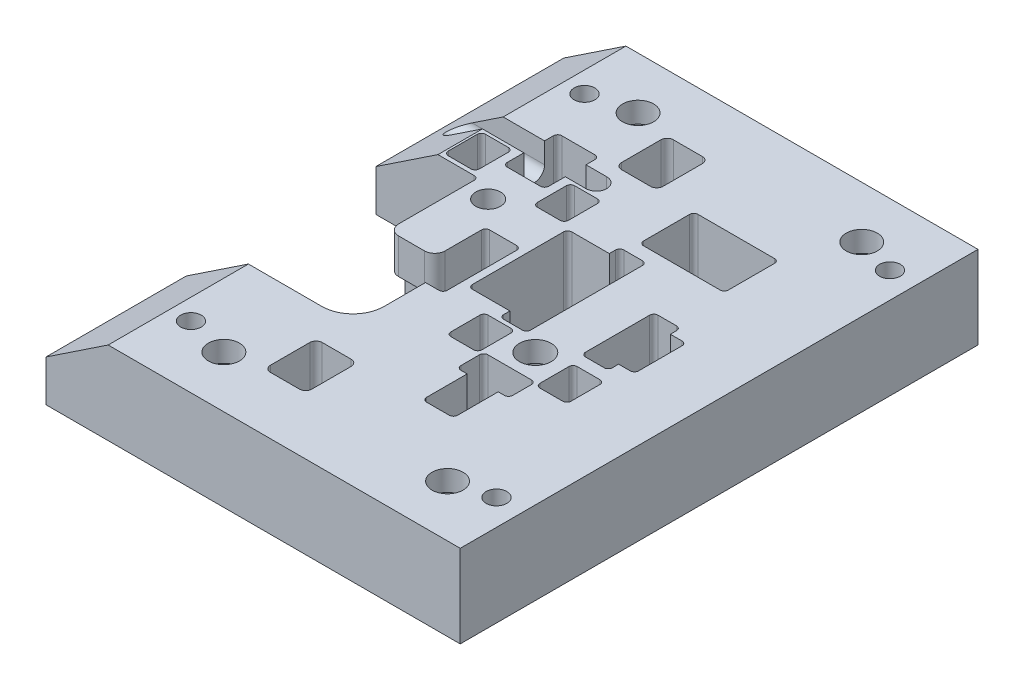
from build123d import *
from OCP.BRepFilletAPI import BRepFilletAPI_MakeChamfer

# Parameters (mm, degrees)
SKETCH1_W                    = 200
SKETCH1_H                    = 250
BOSS_EXTRUDE1_DEPTH          = 40
CUT_EXTRUDE2_REACH           = 167
FILLET3_R                    = 2
CUT_EXTRUDE3_REACH           = 167
FILLET4_R                    = 2
CUT_EXTRUDE4_REACH           = 167
FILLET5_R                    = 2
CUT_EXTRUDE5_REACH           = 167
SKETCH6_W                    = 41
SKETCH6_H                    = 26.3
FILLET6_R                    = 2
CUT_EXTRUDE6_REACH           = 167
CUT_EXTRUDE7_REACH           = 167
CUT_EXTRUDE12_REACH          = 167
CUT_EXTRUDE15_DEPTH          = 5
FILLET9_R                    = 5
CUT_EXTRUDE14_REACH          = 167
CUT_EXTRUDE16_REACH          = 167
FILLET10_R                   = 2
SKETCH27_W                   = 8
SKETCH27_H                   = 23
CUT_EXTRUDE17_DEPTH          = 18.5
FILLET11_R                   = 3
FILLET12_R                   = 15
FILLET13_R                   = 5
CHAMFER1_SIZE                = 20
CHAMFER1_SIZE2               = 30
CUT_EXTRUDE18_REACH          = 167
CUT_EXTRUDE19_REACH          = 167
SKETCH30_R                   = 7.684556177
SKETCH31_R                   = 10
CUT_EXTRUDE20_DEPTH          = 30
CUT_EXTRUDE21_REACH          = 167
SKETCH33_R                   = 6
SKETCH34_R                   = 9
CUT_EXTRUDE22_DEPTH          = 31
M10_TAPPED_HOLE1_D           = 8.5
M10_TAPPED_HOLE1_DEPTH       = 27.5
M10_TAPPED_HOLE1_CSINK_D     = 10.05
M10_TAPPED_HOLE1_CSINK_ANGLE = 90
M10_TAPPED_HOLE1_TIP         = 2.553657631
F_10_0MM_DOWEL_HOLE1_D       = 10
CUT_EXTRUDE23_REACH          = 167
SKETCH41_R                   = 7.5
SKETCH42_R                   = 9
CUT_EXTRUDE24_DEPTH          = 30


with BuildPart() as part:
    # Sketch1 → Boss-Extrude1 (new body)
    with BuildSketch(Plane(origin=(0, 0, 0), x_dir=(1, 0, 0), z_dir=(0, 1, 0))):
        Rectangle(SKETCH1_W, SKETCH1_H)
    extrude(amount=BOSS_EXTRUDE1_DEPTH)

    # Sketch3 → Cut-Extrude2 (cut, up to next)
    with BuildSketch(Plane(origin=(0, 40, 0), x_dir=(1, 0, 0), z_dir=(0, 1, 0)), mode=Mode.PRIVATE) as cut_extrude2_sk1:
        Polygon((28.75, -72.03), (43.75, -72.03), (43.75, -50.4), (48.75, -50.4), (48.75, -37.4), (23.75, -37.4), (23.75, -50.4), (28.75, -50.4), align=None)
    cut_extrude2_tool1 = extrude(cut_extrude2_sk1.sketch, amount=-CUT_EXTRUDE2_REACH, mode=Mode.PRIVATE) & part.part
    add(cut_extrude2_tool1.solids().sort_by_distance((36.25, 40, 52.550168))[0], mode=Mode.SUBTRACT)

    # Fillet3
    fillet3_edges = [part.edges().sort_by_distance(p)[0] for p in [
        (23.75, 20, 50.4),
        (23.75, 20, 37.4),
        (48.75, 20, 37.4),
        (48.75, 20, 50.4),
        (43.75, 20, 72.03),
        (28.75, 20, 72.03),
    ]]
    fillet(fillet3_edges, radius=FILLET3_R)

    # Sketch4 → Cut-Extrude3 (cut, up to next)
    with BuildSketch(Plane(origin=(0, 40, 0), x_dir=(1, 0, 0), z_dir=(0, 1, 0)), mode=Mode.PRIVATE) as cut_extrude3_sk1:
        Polygon((48.25, -14.77), (61.25, -14.77), (61.25, -9.77), (68.88, -9.77), (68.88, 15.23), (61.25, 15.23), (61.25, 20.23), (48.25, 20.23), align=None)
    cut_extrude3_tool1 = extrude(cut_extrude3_sk1.sketch, amount=-CUT_EXTRUDE3_REACH, mode=Mode.PRIVATE) & part.part
    add(cut_extrude3_tool1.solids().sort_by_distance((57.796978, 40, -2.73))[0], mode=Mode.SUBTRACT)

    # Fillet4
    fillet4_edges = [part.edges().sort_by_distance(p)[0] for p in [
        (68.88, 20, 9.77),
        (61.25, 20, 14.77),
        (48.25, 20, 14.77),
        (48.25, 20, -20.23),
        (61.25, 20, -20.23),
        (68.88, 20, -15.23),
    ]]
    fillet(fillet4_edges, radius=FILLET4_R)

    # Sketch5 → Cut-Extrude4 (cut, up to next)
    with BuildSketch(Plane(origin=(0, 40, 0), x_dir=(1, 0, 0), z_dir=(0, 1, 0)), mode=Mode.PRIVATE) as cut_extrude4_sk1:
        Polygon((-7.37, -13.77), (12.75, -13.77), (12.75, -18.77), (25.75, -18.77), (25.75, 39.23), (12.75, 39.23), (12.75, 34.23), (-7.37, 34.23), align=None)
    cut_extrude4_tool1 = extrude(cut_extrude4_sk1.sketch, amount=-CUT_EXTRUDE4_REACH, mode=Mode.PRIVATE) & part.part
    add(cut_extrude4_tool1.solids().sort_by_distance((9.950455, 40, -10.23))[0], mode=Mode.SUBTRACT)

    # Fillet5
    fillet5_edges = [part.edges().sort_by_distance(p)[0] for p in [
        (-7.37, 20, 13.77),
        (-7.37, 20, -34.23),
        (12.75, 20, -39.23),
        (25.75, 20, -39.23),
        (25.75, 20, 18.77),
        (12.75, 20, 18.77),
    ]]
    fillet(fillet5_edges, radius=FILLET5_R)

    # Sketch6 → Cut-Extrude5 (cut, up to next)
    with BuildSketch(Plane(origin=(0, 40, 0), x_dir=(1, 0, 0), z_dir=(0, 1, 0)), mode=Mode.PRIVATE) as cut_extrude5_sk1:
        with Locations((36.25, 58.88)):
            Rectangle(SKETCH6_W, SKETCH6_H)
    cut_extrude5_tool1 = extrude(cut_extrude5_sk1.sketch, amount=-CUT_EXTRUDE5_REACH, mode=Mode.PRIVATE) & part.part
    add(cut_extrude5_tool1.solids().sort_by_distance((36.25, 40, -58.88))[0], mode=Mode.SUBTRACT)

    # Fillet6
    fillet6_edges = [part.edges().sort_by_distance(p)[0] for p in [
        (15.75, 20, -72.03),
        (56.75, 20, -72.03),
        (56.75, 20, -45.73),
        (15.75, 20, -45.73),
    ]]
    fillet(fillet6_edges, radius=FILLET6_R)

    # Sketch7 → Cut-Extrude6 (cut, up to next)
    with BuildSketch(Plane(origin=(0, 40, 0), x_dir=(1, 0, 0), z_dir=(0, 1, 0)), mode=Mode.PRIVATE) as cut_extrude6_sk1:
        with BuildLine():
            Line((63.25, -20.77), (52.25, -20.77))
            ThreePointArc((52.25, -20.77), (50.835786438, -21.355786438), (50.25, -22.77))
            Line((50.25, -22.77), (50.25, -36.77))
            ThreePointArc((50.25, -36.77), (50.835786438, -38.184213562), (52.25, -38.77))
            Line((52.25, -38.77), (63.25, -38.77))
            ThreePointArc((63.25, -38.77), (64.664213562, -38.184213562), (65.25, -36.77))
            Line((65.25, -36.77), (65.25, -22.77))
            ThreePointArc((65.25, -22.77), (64.664213562, -21.355786438), (63.25, -20.77))
        make_face()
    cut_extrude6_tool1 = extrude(cut_extrude6_sk1.sketch, amount=-CUT_EXTRUDE6_REACH, mode=Mode.PRIVATE) & part.part
    add(cut_extrude6_tool1.solids().sort_by_distance((57.75, 40, 29.77))[0], mode=Mode.SUBTRACT)

    # Sketch8 → Cut-Extrude7 (cut, up to next)
    with BuildSketch(Plane(origin=(0, 40, 0), x_dir=(1, 0, 0), z_dir=(0, 1, 0)), mode=Mode.PRIVATE) as cut_extrude7_sk1:
        with BuildLine():
            Line((9.25, -20.77), (20.25, -20.77))
            ThreePointArc((20.25, -20.77), (21.664213562, -21.355786438), (22.25, -22.77))
            Line((22.25, -22.77), (22.25, -36.77))
            ThreePointArc((22.25, -36.77), (21.664213562, -38.184213562), (20.25, -38.77))
            Line((20.25, -38.77), (9.25, -38.77))
            ThreePointArc((9.25, -38.77), (7.835786438, -38.184213562), (7.25, -36.77))
            Line((7.25, -36.77), (7.25, -22.77))
            ThreePointArc((7.25, -22.77), (7.835786438, -21.355786438), (9.25, -20.77))
        make_face()
    cut_extrude7_tool1 = extrude(cut_extrude7_sk1.sketch, amount=-CUT_EXTRUDE7_REACH, mode=Mode.PRIVATE) & part.part
    add(cut_extrude7_tool1.solids().sort_by_distance((14.75, 40, 29.77))[0], mode=Mode.SUBTRACT)

    # Sketch21 → Cut-Extrude12 (cut, up to next)
    with BuildSketch(Plane(origin=(0, 40, 0), x_dir=(1, 0, 0), z_dir=(0, 1, 0)), mode=Mode.PRIVATE) as cut_extrude12_sk1:
        with BuildLine():
            Line((-24, 54.23), (-13, 54.23))
            ThreePointArc((-13, 54.23), (-11.585786438, 53.644213562), (-11, 52.23))
            Line((-11, 52.23), (-11, 38.23))
            ThreePointArc((-11, 38.23), (-11.585786438, 36.815786438), (-13, 36.23))
            Line((-13, 36.23), (-24, 36.23))
            ThreePointArc((-24, 36.23), (-25.414213562, 36.815786438), (-26, 38.23))
            Line((-26, 38.23), (-26, 52.23))
            ThreePointArc((-26, 52.23), (-25.414213562, 53.644213562), (-24, 54.23))
        make_face()
    cut_extrude12_tool1 = extrude(cut_extrude12_sk1.sketch, amount=-CUT_EXTRUDE12_REACH, mode=Mode.PRIVATE) & part.part
    # Sketch21 → Cut-Extrude12 (cut, up to next)
    with BuildSketch(Plane(origin=(0, 40, 0), x_dir=(1, 0, 0), z_dir=(0, 1, 0)), mode=Mode.PRIVATE) as cut_extrude12_sk2:
        with BuildLine():
            Line((-69, 52.23), (-69, 38.23))
            ThreePointArc((-69, 38.23), (-68.414213562, 36.815786438), (-67, 36.23))
            Line((-67, 36.23), (-56, 36.23))
            ThreePointArc((-56, 36.23), (-54.585786438, 36.815786438), (-54, 38.23))
            Line((-54, 38.23), (-54, 52.23))
            ThreePointArc((-54, 52.23), (-54.585786438, 53.644213562), (-56, 54.23))
            Line((-56, 54.23), (-67, 54.23))
            ThreePointArc((-67, 54.23), (-68.414213562, 53.644213562), (-69, 52.23))
        make_face()
    cut_extrude12_tool2 = extrude(cut_extrude12_sk2.sketch, amount=-CUT_EXTRUDE12_REACH, mode=Mode.PRIVATE) & part.part
    add(cut_extrude12_tool1.solids().sort_by_distance((-18.5, 40, -45.23))[0], mode=Mode.SUBTRACT)
    add(cut_extrude12_tool2.solids().sort_by_distance((-61.5, 40, -45.23))[0], mode=Mode.SUBTRACT)

    # Sketch24 → Cut-Extrude15 (cut, symmetric)
    with BuildSketch(Plane(origin=(0, 0, -60.727981881), x_dir=(-1, 0, 0), z_dir=(0, 0, -1))):
        with BuildLine():
            Line((15, 40), (15, 35))
            ThreePointArc((15, 35), (17.928932188, 27.928932188), (25, 25))
            Line((25, 25), (100, 25))
            Line((100, 25), (100, 40))
            Line((100, 40), (15, 40))
        make_face()
    extrude(amount=CUT_EXTRUDE15_DEPTH, both=True, mode=Mode.SUBTRACT)

    # Fillet9
    fillet9_edges = [part.edges().sort_by_distance(p)[0] for p in [
        (-62.5, 25, -55.727981881),
        (-17.928932188, 27.928932188, -55.727981881),
        (-15, 37.5, -55.727981881),
        (-15, 37.5, -65.727981881),
        (-62.5, 25, -65.727981881),
    ]]
    fillet(fillet9_edges, radius=FILLET9_R - 0.0001)  # a hair under: the kernel refuses the full size

    # Sketch23 → Cut-Extrude14 (cut, up to next)
    with BuildSketch(Plane(origin=(0, 40, 0), x_dir=(1, 0, 0), z_dir=(0, 1, 0)), mode=Mode.PRIVATE) as cut_extrude14_sk1:
        with BuildLine():
            Line((-48, 72.03), (-32, 72.03))
            ThreePointArc((-32, 72.03), (-30.585786438, 71.444213562), (-30, 70.03))
            Line((-30, 70.03), (-30, 47.73))
            ThreePointArc((-30, 47.73), (-30.585786438, 46.315786438), (-32, 45.73))
            Line((-32, 45.73), (-48, 45.73))
            ThreePointArc((-48, 45.73), (-49.414213562, 46.315786438), (-50, 47.73))
            Line((-50, 47.73), (-50, 70.03))
            ThreePointArc((-50, 70.03), (-49.414213562, 71.444213562), (-48, 72.03))
        make_face()
    cut_extrude14_tool1 = extrude(cut_extrude14_sk1.sketch, amount=-CUT_EXTRUDE14_REACH, mode=Mode.PRIVATE) & part.part
    add(cut_extrude14_tool1.solids().sort_by_distance((-40, 40, -58.88))[0], mode=Mode.SUBTRACT)

    # Sketch26 → Cut-Extrude16 (cut, up to next)
    with BuildSketch(Plane(origin=(0, 40, 0), x_dir=(1, 0, 0), z_dir=(0, 1, 0)), mode=Mode.PRIVATE) as cut_extrude16_sk1:
        Polygon((-100, 34.23), (-50.5, 34.23), (-50.5, -9.27), (-28, -9.27), (-28, 15.23), (-11, 15.23), (-11, -22.27), (-19.5, -22.27), (-19.5, -57.27), (-100, -57.27), align=None)
    cut_extrude16_tool1 = extrude(cut_extrude16_sk1.sketch, amount=-CUT_EXTRUDE16_REACH, mode=Mode.PRIVATE) & part.part
    add(cut_extrude16_tool1.solids().sort_by_distance((-61.536912, 40, 15.614339))[0], mode=Mode.SUBTRACT)

    # Fillet10
    fillet10_edges = [part.edges().sort_by_distance(p)[0] for p in [
        (-50.5, 20, -34.23),
        (-28, 20, -15.23),
        (-11, 20, -15.23),
        (-11, 20, 22.27),
    ]]
    fillet(fillet10_edges, radius=FILLET10_R)

    # Sketch27 → Cut-Extrude17 (cut)
    with BuildSketch(Plane.ZY.offset(50.5)):
        with Locations((5.27, 11.5)):
            Rectangle(SKETCH27_W, SKETCH27_H)
    extrude(amount=-CUT_EXTRUDE17_DEPTH, mode=Mode.SUBTRACT)

    # Fillet11
    fillet11_edges = [part.edges().sort_by_distance(p)[0] for p in [
        (-41.25, 23, 1.27),
        (-32, 11.5, 1.27),
        (-32, 23, 5.27),
    ]]
    fillet(fillet11_edges, radius=FILLET11_R)

    # Fillet12
    fillet12_edges = [part.edges().sort_by_distance(p)[0] for p in [
        (-19.5, 20, 57.27),
    ]]
    fillet(fillet12_edges, radius=FILLET12_R)

    # Fillet13
    fillet13_edges = [part.edges().sort_by_distance(p)[0] for p in [
        (-50.5, 31.5, 9.27),
        (-28, 20, 9.27),
    ]]
    fillet(fillet13_edges, radius=FILLET13_R)

    # Chamfer1: one chamfer whose edges measure the first distance from different faces: ONE call of the kernel's chamfer builder (chamfer() names one face for all edges)
    chamfer1_edges_1 = [part.edges().sort_by_distance(p)[0] for p in [
        (-100, 40, -44.978990941),
    ]]
    chamfer1_side_1 = [part.faces().sort_by_distance(p)[0] for p in [
        (-100, 19.481783405, -80.368366472),
    ]]
    chamfer1_edges_2 = [part.edges().sort_by_distance(p)[0] for p in [
        (-100, 40, 91.135),
    ]]
    chamfer1_side_2 = [part.faces().sort_by_distance(p)[0] for p in [
        (-100, 20, 91.135),
    ]]
    chamfer1 = BRepFilletAPI_MakeChamfer(part.part.solid().wrapped)
    for e in chamfer1_edges_1:
        chamfer1.Add(CHAMFER1_SIZE, CHAMFER1_SIZE2, e.wrapped, chamfer1_side_1[0].wrapped)  # the first distance lies on this face
    for e in chamfer1_edges_2:
        chamfer1.Add(CHAMFER1_SIZE, CHAMFER1_SIZE2, e.wrapped, chamfer1_side_2[0].wrapped)  # the first distance lies on this face
    add(Compound.cast(chamfer1.Shape()), mode=Mode.REPLACE)

    # Sketch28 → Cut-Extrude18 (cut, up to next)
    with BuildSketch(Plane(origin=(0, 40, 0), x_dir=(1, 0, 0), z_dir=(0, 1, 0)), mode=Mode.PRIVATE) as cut_extrude18_sk1:
        with BuildLine():
            Line((-19.37, 97.265), (-5.37, 97.265))
            ThreePointArc((-5.37, 97.265), (-3.248679656, 96.386320344), (-2.37, 94.265))
            Line((-2.37, 94.265), (-2.37, 75.265))
            ThreePointArc((-2.37, 75.265), (-3.248679656, 73.143679656), (-5.37, 72.265))
            Line((-5.37, 72.265), (-19.37, 72.265))
            ThreePointArc((-19.37, 72.265), (-21.491320344, 73.143679656), (-22.37, 75.265))
            Line((-22.37, 75.265), (-22.37, 94.265))
            ThreePointArc((-22.37, 94.265), (-21.491320344, 96.386320344), (-19.37, 97.265))
        make_face()
    cut_extrude18_tool1 = extrude(cut_extrude18_sk1.sketch, amount=-CUT_EXTRUDE18_REACH, mode=Mode.PRIVATE) & part.part
    cut_extrude18 = cut_extrude18_tool1.solids().sort_by_distance((-12.37, 40, -84.765))[0]
    add(cut_extrude18, mode=Mode.SUBTRACT)

    # Mirror1: Cut-Extrude18 across plane
    add(cut_extrude18.mirror(Plane.XY), mode=Mode.SUBTRACT)

    # Sketch30 → Cut-Extrude19 (cut, up to next)
    with BuildSketch(Plane(origin=(0, 40, 0), x_dir=(1, 0, 0), z_dir=(0, 1, 0)), mode=Mode.PRIVATE) as cut_extrude19_sk1:
        with Locations(Location((36.25, -25, 0), (0, 0, 270))):
            Circle(SKETCH30_R)
    cut_extrude19_tool1 = extrude(cut_extrude19_sk1.sketch, amount=-CUT_EXTRUDE19_REACH, mode=Mode.PRIVATE) & part.part
    add(cut_extrude19_tool1.solids().sort_by_distance((36.25, 40, 25))[0], mode=Mode.SUBTRACT)

    # Sketch31 → Cut-Extrude20 (cut)
    with BuildSketch(Plane.XZ):
        with Locations(Location((36.25, 25, 0), (0, 0, 270))):
            Circle(SKETCH31_R)
    extrude(amount=-CUT_EXTRUDE20_DEPTH, mode=Mode.SUBTRACT)

    # Sketch33 → Cut-Extrude21 (cut, up to next)
    with BuildSketch(Plane(origin=(0, 40, 0), x_dir=(1, 0, 0), z_dir=(0, 1, 0)), mode=Mode.PRIVATE) as cut_extrude21_sk1:
        with Locations(Location((-39.25, 27.73, 0), (0, 0, 270))):
            Circle(SKETCH33_R)
    cut_extrude21_tool1 = extrude(cut_extrude21_sk1.sketch, amount=-CUT_EXTRUDE21_REACH, mode=Mode.PRIVATE) & part.part
    add(cut_extrude21_tool1.solids().sort_by_distance((-39.25, 40, -27.73))[0], mode=Mode.SUBTRACT)

    # Sketch34 → Cut-Extrude22 (cut)
    with BuildSketch(Plane.XZ):
        with Locations(Location((-39.25, -27.73, 0), (0, 0, 270))):
            Circle(SKETCH34_R)
    extrude(amount=-CUT_EXTRUDE22_DEPTH, mode=Mode.SUBTRACT)

    # M10 Tapped Hole1
    with Locations(Plane(origin=(0, 0, 0), x_dir=(-1, 0, 0), z_dir=(0, -1, 0))):
        with Locations((-87.5, 112.5), (60, 112.5), (60, -112.5), (-87.5, -112.5)):
            CounterSinkHole(M10_TAPPED_HOLE1_D / 2, M10_TAPPED_HOLE1_CSINK_D / 2, depth=M10_TAPPED_HOLE1_DEPTH, counter_sink_angle=M10_TAPPED_HOLE1_CSINK_ANGLE)
            with Locations((0, 0, -(M10_TAPPED_HOLE1_DEPTH + M10_TAPPED_HOLE1_TIP / 2))):  # 118° drill point
                Cone(0, M10_TAPPED_HOLE1_D / 2, M10_TAPPED_HOLE1_TIP, mode=Mode.SUBTRACT)

    # Ø10.0mm Dowel Hole1 (through all)
    with Locations(Plane(origin=(0, 0, 0), x_dir=(-1, 0, 0), z_dir=(0, -1, 0))):
        with Locations((-87.5, 95), (60, 95), (60, -95), (-87.5, -95)):
            Hole(F_10_0MM_DOWEL_HOLE1_D / 2)

    # Sketch41 → Cut-Extrude23 (cut, up to next)
    with BuildSketch(Plane(origin=(0, 40, 0), x_dir=(1, 0, 0), z_dir=(0, 1, 0)), mode=Mode.PRIVATE) as cut_extrude23_sk1:
        with Locations(Location((68.88, -100, 0), (0, 0, 270))):
            Circle(SKETCH41_R)
    cut_extrude23_tool1 = extrude(cut_extrude23_sk1.sketch, amount=-CUT_EXTRUDE23_REACH, mode=Mode.PRIVATE) & part.part
    # Sketch41 → Cut-Extrude23 (cut, up to next)
    with BuildSketch(Plane(origin=(0, 40, 0), x_dir=(1, 0, 0), z_dir=(0, 1, 0)), mode=Mode.PRIVATE) as cut_extrude23_sk2:
        with Locations(Location((-39.12, -100, 0), (0, 0, 270))):
            Circle(SKETCH41_R)
    cut_extrude23_tool2 = extrude(cut_extrude23_sk2.sketch, amount=-CUT_EXTRUDE23_REACH, mode=Mode.PRIVATE) & part.part
    # Sketch41 → Cut-Extrude23 (cut, up to next)
    with BuildSketch(Plane(origin=(0, 40, 0), x_dir=(1, 0, 0), z_dir=(0, 1, 0)), mode=Mode.PRIVATE) as cut_extrude23_sk3:
        with Locations(Location((68.88, 100, 0), (0, 0, 90))):
            Circle(SKETCH41_R)
    cut_extrude23_tool3 = extrude(cut_extrude23_sk3.sketch, amount=-CUT_EXTRUDE23_REACH, mode=Mode.PRIVATE) & part.part
    # Sketch41 → Cut-Extrude23 (cut, up to next)
    with BuildSketch(Plane(origin=(0, 40, 0), x_dir=(1, 0, 0), z_dir=(0, 1, 0)), mode=Mode.PRIVATE) as cut_extrude23_sk4:
        with Locations(Location((-39.12, 100, 0), (0, 0, 90))):
            Circle(SKETCH41_R)
    cut_extrude23_tool4 = extrude(cut_extrude23_sk4.sketch, amount=-CUT_EXTRUDE23_REACH, mode=Mode.PRIVATE) & part.part
    add(cut_extrude23_tool1.solids().sort_by_distance((68.88, 40, 100))[0], mode=Mode.SUBTRACT)
    add(cut_extrude23_tool2.solids().sort_by_distance((-39.12, 40, 100))[0], mode=Mode.SUBTRACT)
    add(cut_extrude23_tool3.solids().sort_by_distance((68.88, 40, -100))[0], mode=Mode.SUBTRACT)
    add(cut_extrude23_tool4.solids().sort_by_distance((-39.12, 40, -100))[0], mode=Mode.SUBTRACT)

    # Sketch42 → Cut-Extrude24 (cut)
    with BuildSketch(Plane.XZ):
        with Locations(Location((68.88, 100, 0), (0, 0, 270))):
            Circle(SKETCH42_R)
        with Locations(Location((-39.12, 100, 0), (0, 0, 270))):
            Circle(SKETCH42_R)
        with Locations(Location((68.88, -100, 0), (0, 0, 270))):
            Circle(SKETCH42_R)
        with Locations(Location((-39.12, -100, 0), (0, 0, 270))):
            Circle(SKETCH42_R)
    extrude(amount=-CUT_EXTRUDE24_DEPTH, mode=Mode.SUBTRACT)


solid = part.part
